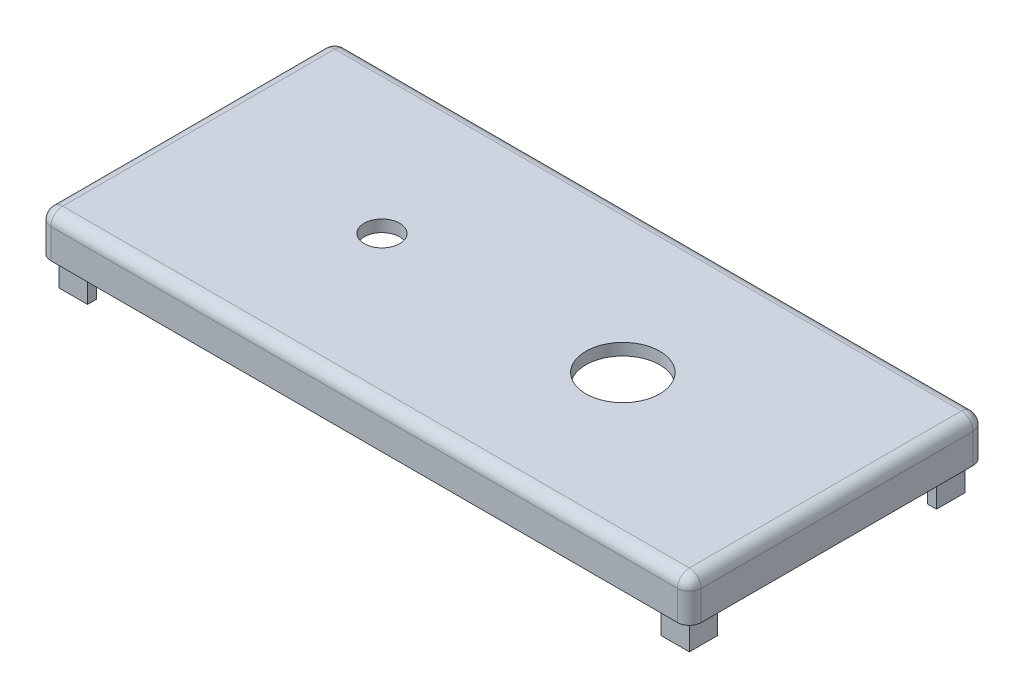
from build123d import *

# Parameters (mm, degrees)
STOCK_FULL_START                 = 48
STOCK_FULL_SHAPE_1_OUTLINE_W     = 110
STOCK_FULL_SHAPE_1_OUTLINE_H     = 50
STOCK_FULL_SHAPE_1_DEPTH         = 2
STOCK_FULL_START_2               = 45
STOCK_FULL_SHAPE_1_2_OUTLINE_W   = 110
STOCK_FULL_SHAPE_1_2_OUTLINE_H   = 50
STOCK_FULL_SHAPE_1_2_OUTLINE_W_2 = 107
STOCK_FULL_SHAPE_1_2_OUTLINE_H_2 = 47
STOCK_FULL_SHAPE_1_2_DEPTH       = 3
SKETCH1_W                        = 110
SKETCH1_H                        = 50
SKETCH1_W_2                      = 107
SKETCH1_H_2                      = 47
BOSS_EXTRUDE1_DEPTH              = 2
BOSS_EXTRUDE2_DEPTH              = 10
BOSS_EXTRUDE3_DEPTH              = 5
SKETCH6_R                        = 6.25
SKETCH6_R_2                      = 3
CUT_EXTRUDE1_DEPTH               = 5
FILLET1_R                        = 2
FILLET2_R                        = 2


# Read off the part's stored shape, not the designer's step: Stock-full shape-1
with BuildPart() as part:
    # Stock-full shape-1 outline → Stock-full shape-1 (new body)
    with BuildSketch(Plane(origin=(0, 0, 0), x_dir=(1, 0, 0), z_dir=(0, 1, 0)).offset(STOCK_FULL_START)):
        with Locations((14.090909091, -5.886363636)):
            Rectangle(STOCK_FULL_SHAPE_1_OUTLINE_W, STOCK_FULL_SHAPE_1_OUTLINE_H)
    extrude(amount=STOCK_FULL_SHAPE_1_DEPTH)

    # Stock-full shape-1 2 outline → Stock-full shape-1 2 (add)
    with BuildSketch(Plane(origin=(0, 0, 0), x_dir=(1, 0, 0), z_dir=(0, 1, 0)).offset(STOCK_FULL_START_2)):
        with Locations((14.090909091, -5.886363636)):
            Rectangle(STOCK_FULL_SHAPE_1_2_OUTLINE_W, STOCK_FULL_SHAPE_1_2_OUTLINE_H)
        with Locations((14.090909091, -5.886363636)):
            Rectangle(STOCK_FULL_SHAPE_1_2_OUTLINE_W_2, STOCK_FULL_SHAPE_1_2_OUTLINE_H_2, mode=Mode.SUBTRACT)
    extrude(amount=STOCK_FULL_SHAPE_1_2_DEPTH)

    # Sketch1 → Boss-Extrude1 (add)
    with BuildSketch(Plane(origin=(0, 45, 0), x_dir=(-1, 0, 0), z_dir=(0, -1, 0))):
        with Locations((-14.090909091, -5.886363636)):
            Rectangle(SKETCH1_W, SKETCH1_H)
        with Locations((-14.090909091, -5.886363636)):
            Rectangle(SKETCH1_W_2, SKETCH1_H_2, mode=Mode.SUBTRACT)
    extrude(amount=BOSS_EXTRUDE1_DEPTH)

    # Sketch3 → Boss-Extrude2 (add)
    with BuildSketch(Plane.XZ.offset(-48)):
        Polygon((-39.209090909, 24.386363636), (-39.209090909, 29.186363636), (-34.409090909, 29.186363636), (-34.409090909, 27.686363636), (-37.709090909, 27.686363636), (-37.709090909, 24.386363636), align=None)
        Polygon((62.590909091, 29.186363636), (67.390909091, 29.186363636), (67.390909091, 24.386363636), (65.890909091, 24.386363636), (65.890909091, 27.686363636), (62.590909091, 27.686363636), align=None)
        Polygon((67.390909091, -12.613636364), (65.890909091, -12.613636364), (65.890909091, -15.913636364), (62.590909091, -15.913636364), (62.590909091, -17.413636364), (67.390909091, -17.413636364), align=None)
        Polygon((-39.209090909, -12.613636364), (-39.209090909, -17.413636364), (-34.409090909, -17.413636364), (-34.409090909, -15.913636364), (-37.709090909, -15.913636364), (-37.709090909, -12.613636364), align=None)
    extrude(amount=BOSS_EXTRUDE2_DEPTH)

    # Sketch5 → Boss-Extrude3 (add)
    with BuildSketch(Plane.XZ.offset(-48)):
        Polygon((-39.209090909, -12.613636364), (-39.209090909, -17.413636364), (-34.409090909, -17.413636364), (-34.409090909, -17.613636364), (-39.409090909, -17.613636364), (-39.409090909, -12.613636364), align=None)
        Polygon((-39.409090909, 24.386363636), (-39.209090909, 24.386363636), (-39.209090909, 29.186363636), (-34.409090909, 29.186363636), (-34.409090909, 29.386363636), (-39.409090909, 29.386363636), align=None)
        Polygon((67.590909091, 24.386363636), (67.390909091, 24.386363636), (67.390909091, 29.186363636), (62.590909091, 29.186363636), (62.590909091, 29.386363636), (67.590909091, 29.386363636), align=None)
        Polygon((67.390909091, -17.413636364), (67.390909091, -12.613636364), (67.590909091, -12.613636364), (67.590909091, -17.613636364), (62.590909091, -17.613636364), (62.590909091, -17.413636364), align=None)
    extrude(amount=BOSS_EXTRUDE3_DEPTH)

    # Sketch6 → Cut-Extrude1 (cut)
    with BuildSketch(Plane(origin=(0, 50, 0), x_dir=(1, 0, 0), z_dir=(0, 1, 0))):
        with Locations(Location((32.840909091, -5.886363636, 0), (0, 0, 270))):
            Circle(SKETCH6_R)
        with Locations(Location((-7.909090909, -5.886363636, 0), (0, 0, 270))):
            Circle(SKETCH6_R_2)
    extrude(amount=-CUT_EXTRUDE1_DEPTH, mode=Mode.SUBTRACT)

    # Fillet1
    fillet1_edges = [part.edges().sort_by_distance(p)[0] for p in [
        (-40.909090909, 50, 5.886363636),
        (14.090909091, 50, 30.886363636),
        (69.090909091, 50, 5.886363636),
        (14.090909091, 50, -19.113636364),
    ]]
    fillet(fillet1_edges, radius=FILLET1_R)

    # Fillet2
    # the kernel refuses this fillet: 2 mm, written as the material it takes off along each edge
    with BuildSketch(Plane(origin=(-38.909090909, 48, 28.886363636), x_dir=(0, 0, 1), z_dir=(-1, 0, 0))) as fillet2_piece_1_section:
        Polygon((0, 0), (FILLET2_R, 0), (FILLET2_R, FILLET2_R), (0, FILLET2_R), align=None)
    fillet2_piece_1 = extrude(amount=FILLET2_R, mode=Mode.PRIVATE)
    fillet2_piece_1 = fillet2_piece_1 - Plane(origin=(-38.909090909, 48, 28.886363636), x_dir=(0, -0.7071067811865475, -0.7071067811865475), z_dir=(-1, 0, 0)) * Sphere(FILLET2_R, mode=Mode.PRIVATE)
    add(fillet2_piece_1, mode=Mode.SUBTRACT)
    with BuildSketch(Plane(origin=(-38.909090909, 48, -17.113636364), x_dir=(0, 0, -1), z_dir=(-1, 0, 0))) as fillet2_piece_2_section:
        Polygon((0, 0), (FILLET2_R, 0), (FILLET2_R, -FILLET2_R), (0, -FILLET2_R), align=None)
    fillet2_piece_2 = extrude(amount=FILLET2_R, mode=Mode.PRIVATE)
    fillet2_piece_2 = fillet2_piece_2 - Plane(origin=(-38.909090909, 48, -17.113636364), x_dir=(0, -0.7071067811865475, 0.7071067811865475), z_dir=(-1, 0, 0)) * Sphere(FILLET2_R, mode=Mode.PRIVATE)
    add(fillet2_piece_2, mode=Mode.SUBTRACT)
    with BuildSketch(Plane(origin=(67.090909091, 48, 28.886363636), x_dir=(1, 0, 0), z_dir=(0, 0, 1))) as fillet2_piece_3_section:
        Polygon((0, 0), (FILLET2_R, 0), (FILLET2_R, FILLET2_R), (0, FILLET2_R), align=None)
    fillet2_piece_3 = extrude(amount=FILLET2_R, mode=Mode.PRIVATE)
    fillet2_piece_3 = fillet2_piece_3 - Plane(origin=(67.090909091, 48, 28.886363636), x_dir=(-0.7071067811865475, -0.7071067811865475, 0), z_dir=(0, 0, 1)) * Sphere(FILLET2_R, mode=Mode.PRIVATE)
    add(fillet2_piece_3, mode=Mode.SUBTRACT)
    with BuildSketch(Plane(origin=(67.090909091, 48, -17.113636364), x_dir=(1, 0, 0), z_dir=(0, 0, -1))) as fillet2_piece_4_section:
        Polygon((0, 0), (FILLET2_R, 0), (FILLET2_R, -FILLET2_R), (0, -FILLET2_R), align=None)
    fillet2_piece_4 = extrude(amount=FILLET2_R, mode=Mode.PRIVATE)
    fillet2_piece_4 = fillet2_piece_4 - Plane(origin=(67.090909091, 48, -17.113636364), x_dir=(-0.7071067811865475, -0.7071067811865475, 0), z_dir=(0, 0, -1)) * Sphere(FILLET2_R, mode=Mode.PRIVATE)
    add(fillet2_piece_4, mode=Mode.SUBTRACT)
    with BuildSketch(Plane(origin=(69.090909091, 45, 30.886363636), x_dir=(-1, 0, 0), z_dir=(0, 1, 0)), Plane(origin=(69.090909091, 48, -19.113636364), x_dir=(-1, 0, 0), z_dir=(0, -1, 0)), Plane(origin=(-40.909090909, 45, 30.886363636), x_dir=(0, 0, -1), z_dir=(0, 1, 0))) as fillet2_piece_5:
        with BuildLine():
            CenterArc((FILLET2_R, -FILLET2_R), FILLET2_R, 90, 90)
            Line((0, -FILLET2_R), (0, 0))
            Line((0, 0), (FILLET2_R, 0))
        make_face()
    extrude(amount=3, mode=Mode.SUBTRACT)
    with BuildSketch(Plane(origin=(-40.909090909, 48, -19.113636364), x_dir=(1.2985168496859017e-11, 5.194777941125234e-11, 1.0), z_dir=(-1.2986691087592473e-11, -1.0, 5.1947779411420976e-11))) as fillet2_piece_6:
        with BuildLine():
            CenterArc((FILLET2_R, -FILLET2_R), FILLET2_R, 90.000000001, 90)
            Line((0, -FILLET2_R), (0, 0))
            Line((0, 0), (FILLET2_R, 0))
        make_face()
    extrude(amount=10, mode=Mode.SUBTRACT)
    with BuildSketch(Plane(origin=(-40.909090909, 45, 30.886363636), x_dir=(4.545341879830931e-11, 0, -1.0), z_dir=(0, -1, 0)), Plane(origin=(69.090909091, 45, 30.886363636), x_dir=(-1.0, 0, -1.8181900430507692e-10), z_dir=(0, -1, 0))) as fillet2_piece_7:
        with BuildLine():
            CenterArc((FILLET2_R, FILLET2_R), FILLET2_R, 179.999999997, 90)
            Line((FILLET2_R * 2.27272423097e-10, FILLET2_R), (0, 0))
            Line((0, 0), (FILLET2_R, 0))
        make_face()
    extrude(amount=7.000000001, mode=Mode.SUBTRACT)
    with BuildSketch(Plane(origin=(69.090909091, 45, -19.113636364), x_dir=(-1.0, 0, -1.8181722794823744e-10), z_dir=(0, -1, 0))) as fillet2_piece_8:
        with BuildLine():
            CenterArc((FILLET2_R, -FILLET2_R), FILLET2_R, 89.99999999, 90)
            Line((-FILLET2_R * 2.27270646722e-10, -FILLET2_R), (0, 0))
            Line((0, 0), (FILLET2_R, 0))
        make_face()
    extrude(amount=7, mode=Mode.SUBTRACT)


solid = part.part
